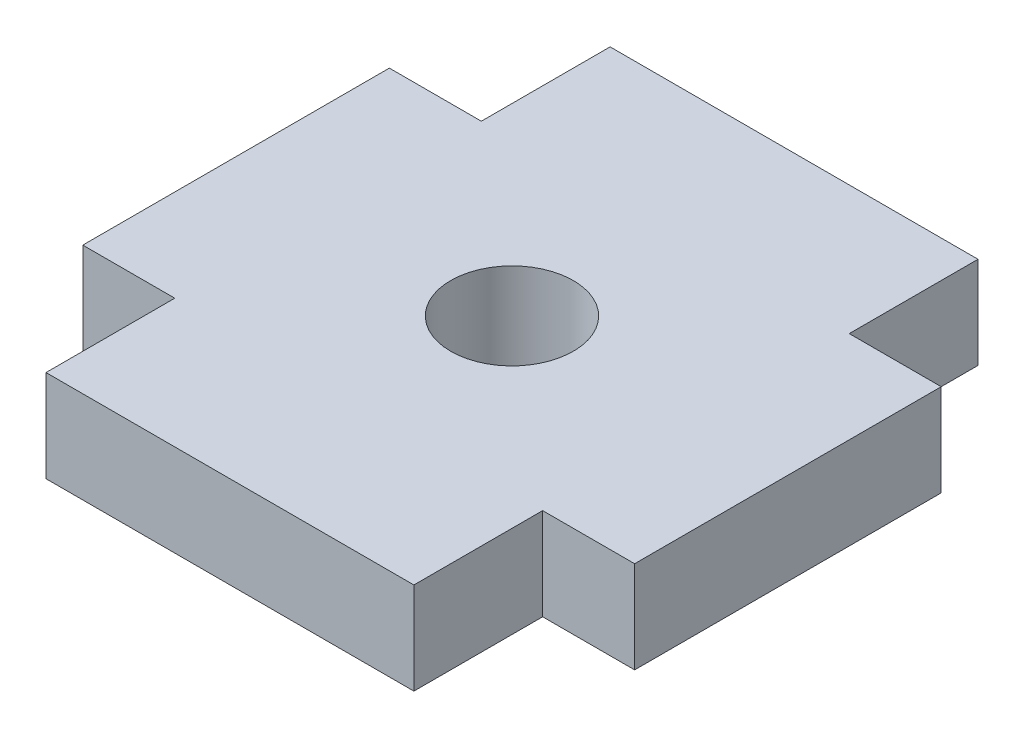
from build123d import *

# Parameters (mm, degrees)
ESBO_O1_R                = 2
RESSALTO_EXTRUS_O1_DEPTH = 3


with BuildPart() as part:
    # Esboço1 → Ressalto-extrusão1 (new body)
    with BuildSketch(Plane.XZ.offset(-10)):
        Polygon((-64.5, -9.199919627), (-64.5, -5), (-61.5, -5), (-61.5, 5), (-64.5, 5), (-64.5, 9.199919627), (-76.5, 9.199919627), (-76.5, 5), (-79.5, 5), (-79.5, -5), (-76.5, -5), (-76.5, -9.199919627), align=None)
        with Locations((-70.5, 0)):
            Circle(ESBO_O1_R, mode=Mode.SUBTRACT)
    extrude(amount=-RESSALTO_EXTRUS_O1_DEPTH)


solid = part.part
